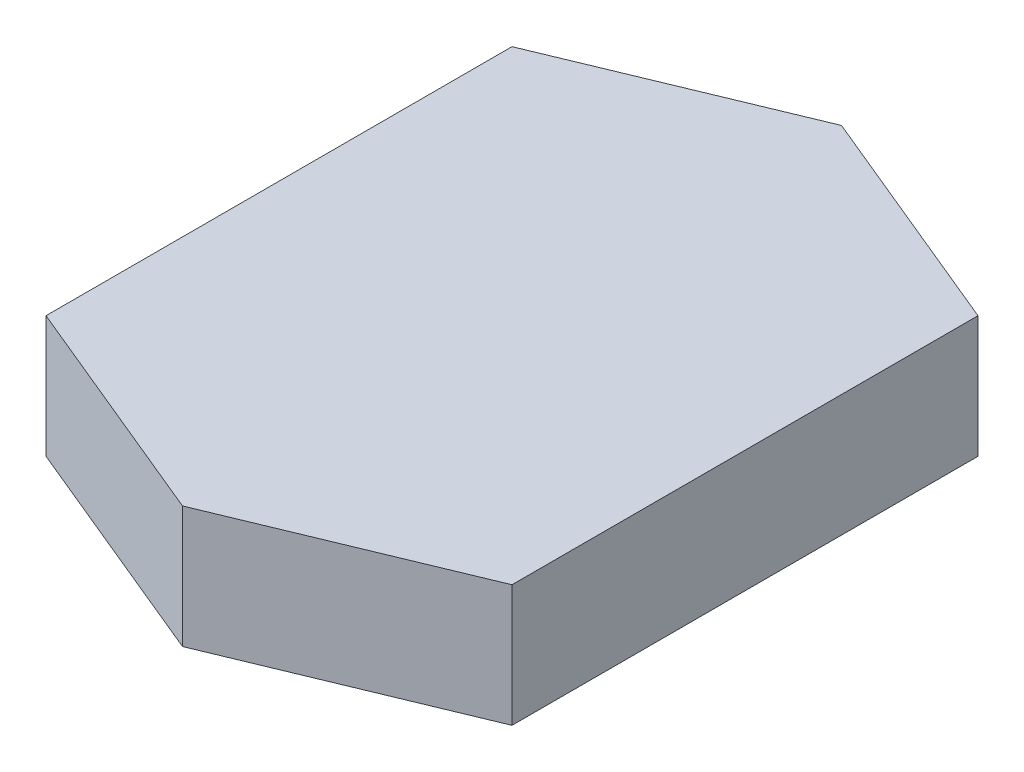
from build123d import *

# Parameters (mm, degrees)
BOSS_EXTRUDE1_DEPTH   = 10
BODY_MOVE_COPY1_DEPTH = 10


# Read off the part's stored shape, not the designer's step: Body-Move/Copy1
with BuildPart() as part:
    # Sketch1 → Boss-Extrude1 (new body)
    with BuildSketch(Plane(origin=(0, 0, 0), x_dir=(1, 0, 0), z_dir=(0, 1, 0))):
        Polygon((0, 27.059805007), (19.134171618, 19.134171618), (19.134171618, -19.134171618), (0, -27.059805007), (-19.134171618, -19.134171618), (-19.134171618, 19.134171618), align=None)
    extrude(amount=BOSS_EXTRUDE1_DEPTH)


with BuildPart() as body_2:
    # Body-Move/Copy1 outline → Body-Move/Copy1 (new body)
    with BuildSketch(Plane(origin=(0, 0, 0), x_dir=(1, 0, 0), z_dir=(0, 1, 0))):
        Polygon((0, 27.059805007), (-19.134171618, 19.134171618), (-19.134171618, -19.134171618), (0, -27.059805007), (19.134171618, -19.134171618), (19.134171618, 19.134171618), align=None)
    extrude(amount=BODY_MOVE_COPY1_DEPTH)


solid = Compound([part.part, body_2.part])
